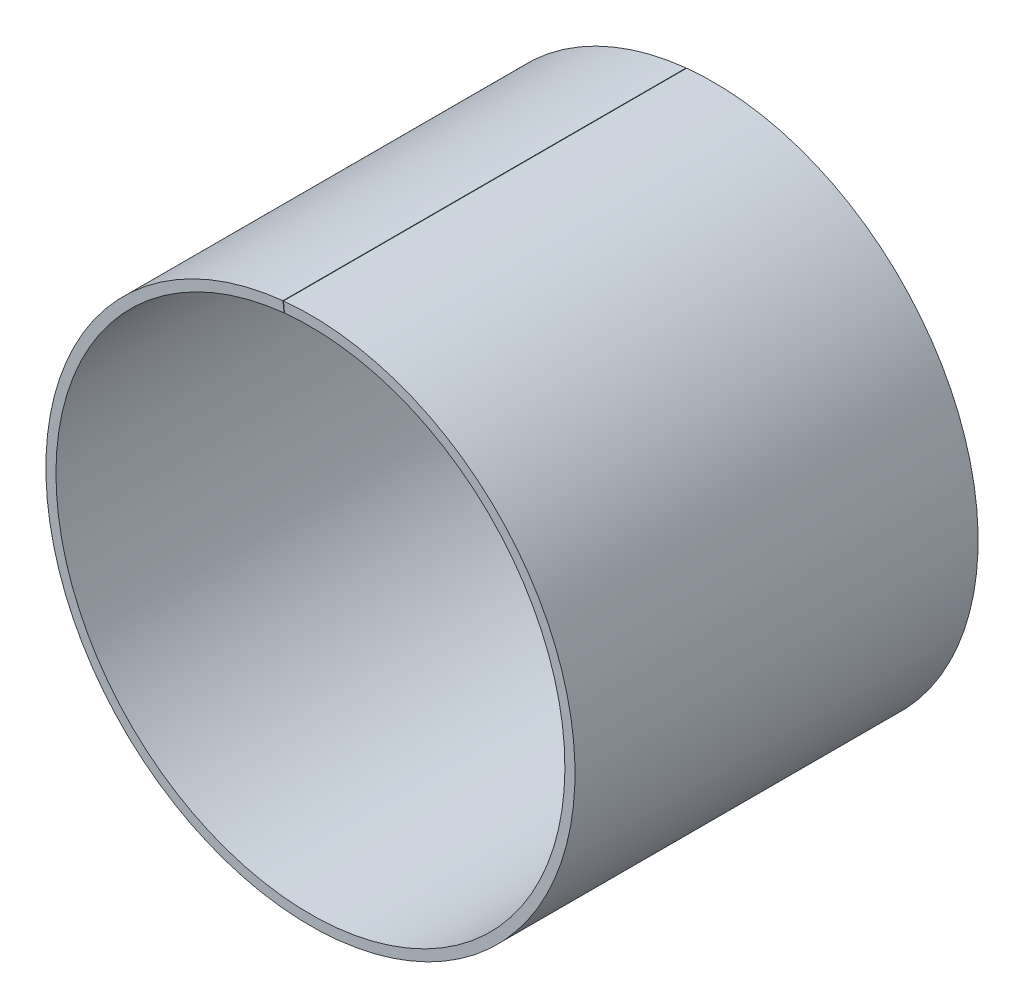
from build123d import *

# Parameters (mm, degrees)
BASE_FLANGE1_DEPTH = 80


# Sheet-metal steps are written as plain solids
with BuildPart() as part:
    # Sketch1 → Base-Flange1 (new body)
    with BuildSketch(Plane.XY):
        with BuildLine():
            ThreePointArc((-5.239688099, 50.227439399), (5.189190721, -50.232681589), (-5.138688099, 50.237873011))
            Line((-5.138688099, 50.237873011), (-5.342200499, 52.227491744))
            ThreePointArc((-5.342200499, 52.227491744), (5.394703225, -52.222094722), (-5.447200499, 52.21664492))
            Line((-5.447200499, 52.21664492), (-5.239688099, 50.227439399))
        make_face()
    extrude(amount=BASE_FLANGE1_DEPTH)


solid = part.part
